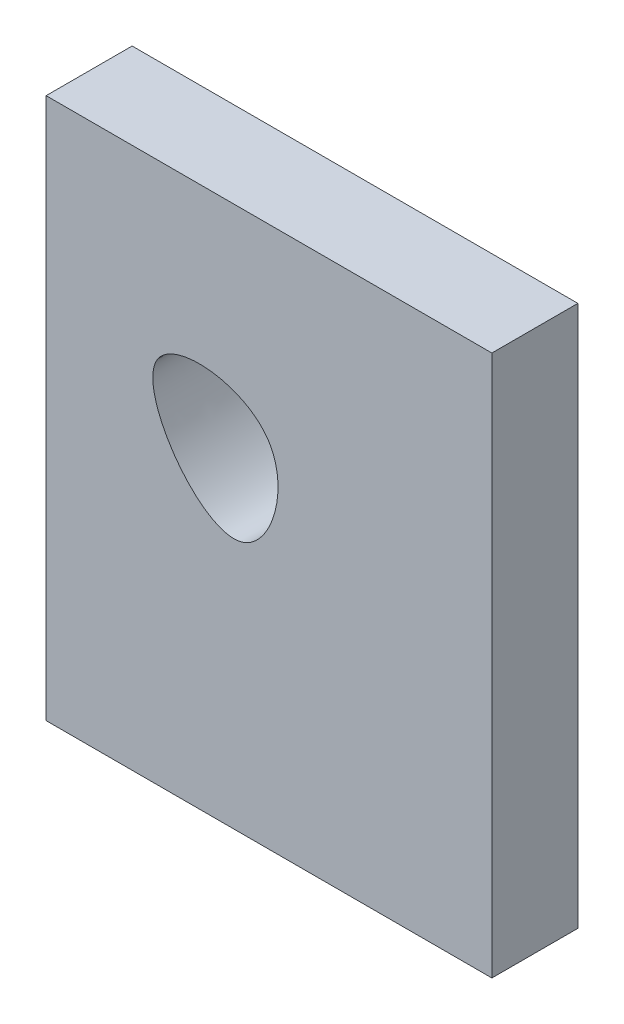
from build123d import *

# Parameters (mm, degrees)
THICKEN_START       = -10
THICKEN_1_OUTLINE_W = 51.835740335
THICKEN_1_OUTLINE_H = 62.943398979
THICKEN_1_DEPTH     = 10


# Read off the part's stored shape, not the designer's step: Придать толщину1
with BuildPart() as part:
    # Придать толщину1 outline → Придать толщину1 (new body)
    with BuildSketch(Plane.XY.offset(THICKEN_START)):
        with Locations((-39.031078289, -0.617092147)):
            Rectangle(THICKEN_1_OUTLINE_W, THICKEN_1_OUTLINE_H)
        with BuildLine():
            add(Edge.make_bspline(
                [(-51.990013372, 10.79911257), (-54.604406091, 6.724584095), (-41.961423525, -11.538827577), (-34.058339356, 12.470514149), (-49.929227681, 14.010845038), (-51.990013372, 10.79911257)],
                knots=[0, 0, 0, 0, 0.396316014, 0.687605322, 1, 1, 1, 1], degree=3))
        make_face(mode=Mode.SUBTRACT)
    extrude(amount=THICKEN_1_DEPTH)


solid = part.part
